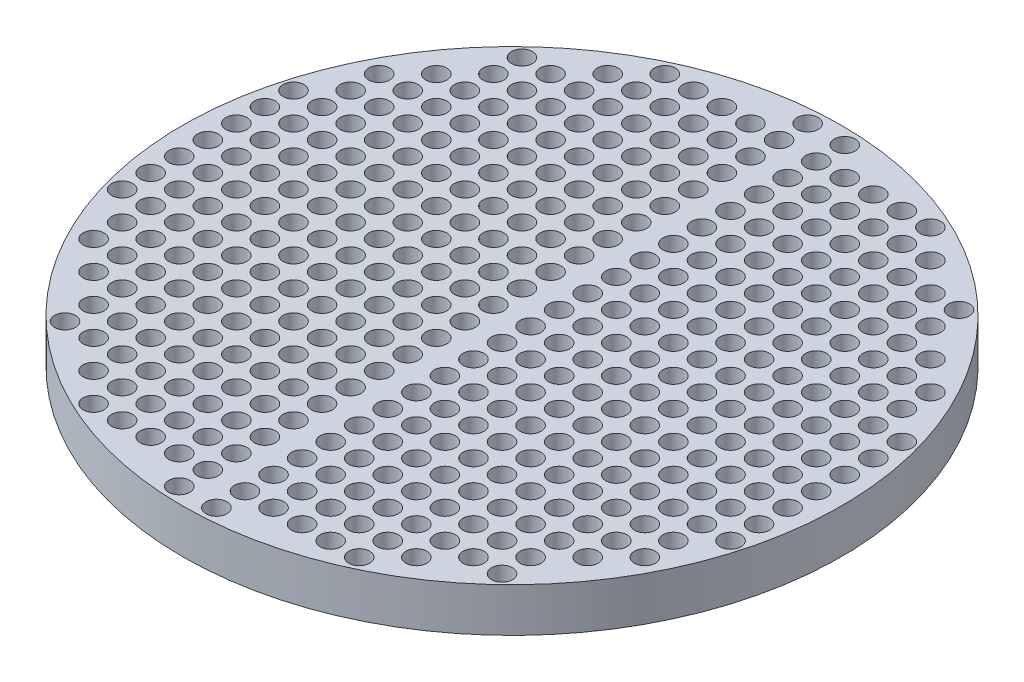
from build123d import *

# Parameters (mm, degrees)
SKETCH2_R          = 9.525
CUT_EXTRUDE1_DEPTH = 427.145515053


with BuildPart() as part:
    # Эскиз1 → Повернуть1 (revolve)
    with BuildSketch(Plane.XY):
        Polygon((-230, 35), (-259, 35), (-300, 35), (-300, 75), (0, 75), (0, 35), align=None)
    revolve(axis=Axis((0, 0, 0), (0, 1, 0)))

    # Sketch2 → Cut-Extrude1 (cut, through all)
    with BuildSketch(Plane(origin=(0, 75, 0), x_dir=(1, 0, 0), z_dir=(0, 1, 0))):
        with Locations((16.915767562, 0)):
            Circle(SKETCH2_R)
        with Locations((42.915767562, 0)):
            Circle(SKETCH2_R)
        with Locations((68.915767562, 0)):
            Circle(SKETCH2_R)
        with Locations((94.915767562, 0)):
            Circle(SKETCH2_R)
        with Locations((120.915767562, 0)):
            Circle(SKETCH2_R)
        with Locations((146.915767562, 0)):
            Circle(SKETCH2_R)
        with Locations((172.915767562, 0)):
            Circle(SKETCH2_R)
        with Locations((198.915767562, 0)):
            Circle(SKETCH2_R)
        with Locations((224.915767562, 0)):
            Circle(SKETCH2_R)
        with Locations((250.915767562, 0)):
            Circle(SKETCH2_R)
        with Locations((276.915767562, 0)):
            Circle(SKETCH2_R)
        with Locations((42.915767562, 26)):
            Circle(SKETCH2_R)
        with Locations((68.915767562, 26)):
            Circle(SKETCH2_R)
        with Locations((94.915767562, 26)):
            Circle(SKETCH2_R)
        with Locations((120.915767562, 26)):
            Circle(SKETCH2_R)
        with Locations((146.915767562, 26)):
            Circle(SKETCH2_R)
        with Locations((172.915767562, 26)):
            Circle(SKETCH2_R)
        with Locations((198.915767562, 26)):
            Circle(SKETCH2_R)
        with Locations((224.915767562, 26)):
            Circle(SKETCH2_R)
        with Locations((250.915767562, 26)):
            Circle(SKETCH2_R)
        with Locations((276.915767562, 26)):
            Circle(SKETCH2_R)
        with Locations((42.915767562, 52)):
            Circle(SKETCH2_R)
        with Locations((68.915767562, 52)):
            Circle(SKETCH2_R)
        with Locations((94.915767562, 52)):
            Circle(SKETCH2_R)
        with Locations((120.915767562, 52)):
            Circle(SKETCH2_R)
        with Locations((146.915767562, 52)):
            Circle(SKETCH2_R)
        with Locations((172.915767562, 52)):
            Circle(SKETCH2_R)
        with Locations((198.915767562, 52)):
            Circle(SKETCH2_R)
        with Locations((224.915767562, 52)):
            Circle(SKETCH2_R)
        with Locations((250.915767562, 52)):
            Circle(SKETCH2_R)
        with Locations((276.915767562, 52)):
            Circle(SKETCH2_R)
        with Locations((42.915767562, 78)):
            Circle(SKETCH2_R)
        with Locations((68.915767562, 78)):
            Circle(SKETCH2_R)
        with Locations((94.915767562, 78)):
            Circle(SKETCH2_R)
        with Locations((120.915767562, 78)):
            Circle(SKETCH2_R)
        with Locations((146.915767562, 78)):
            Circle(SKETCH2_R)
        with Locations((172.915767562, 78)):
            Circle(SKETCH2_R)
        with Locations((198.915767562, 78)):
            Circle(SKETCH2_R)
        with Locations((224.915767562, 78)):
            Circle(SKETCH2_R)
        with Locations((250.915767562, 78)):
            Circle(SKETCH2_R)
        with Locations((276.915767562, 78)):
            Circle(SKETCH2_R)
        with Locations((42.915767562, 104)):
            Circle(SKETCH2_R)
        with Locations((68.915767562, 104)):
            Circle(SKETCH2_R)
        with Locations((94.915767562, 104)):
            Circle(SKETCH2_R)
        with Locations((120.915767562, 104)):
            Circle(SKETCH2_R)
        with Locations((146.915767562, 104)):
            Circle(SKETCH2_R)
        with Locations((172.915767562, 104)):
            Circle(SKETCH2_R)
        with Locations((198.915767562, 104)):
            Circle(SKETCH2_R)
        with Locations((224.915767562, 104)):
            Circle(SKETCH2_R)
        with Locations((250.915767562, 104)):
            Circle(SKETCH2_R)
        with Locations((16.915767562, -286)):
            Circle(SKETCH2_R)
        with Locations((42.915767562, 130)):
            Circle(SKETCH2_R)
        with Locations((68.915767562, 130)):
            Circle(SKETCH2_R)
        with Locations((94.915767562, 130)):
            Circle(SKETCH2_R)
        with Locations((120.915767562, 130)):
            Circle(SKETCH2_R)
        with Locations((146.915767562, 130)):
            Circle(SKETCH2_R)
        with Locations((172.915767562, 130)):
            Circle(SKETCH2_R)
        with Locations((198.915767562, 130)):
            Circle(SKETCH2_R)
        with Locations((224.915767562, 130)):
            Circle(SKETCH2_R)
        with Locations((250.915767562, 130)):
            Circle(SKETCH2_R)
        with Locations((16.915767562, -260)):
            Circle(SKETCH2_R)
        with Locations((42.915767562, 156)):
            Circle(SKETCH2_R)
        with Locations((68.915767562, 156)):
            Circle(SKETCH2_R)
        with Locations((94.915767562, 156)):
            Circle(SKETCH2_R)
        with Locations((120.915767562, 156)):
            Circle(SKETCH2_R)
        with Locations((146.915767562, 156)):
            Circle(SKETCH2_R)
        with Locations((172.915767562, 156)):
            Circle(SKETCH2_R)
        with Locations((198.915767562, 156)):
            Circle(SKETCH2_R)
        with Locations((224.915767562, 156)):
            Circle(SKETCH2_R)
        with Locations((16.915767562, -234)):
            Circle(SKETCH2_R)
        with Locations((16.915767562, -208)):
            Circle(SKETCH2_R)
        with Locations((42.915767562, 182)):
            Circle(SKETCH2_R)
        with Locations((68.915767562, 182)):
            Circle(SKETCH2_R)
        with Locations((94.915767562, 182)):
            Circle(SKETCH2_R)
        with Locations((120.915767562, 182)):
            Circle(SKETCH2_R)
        with Locations((146.915767562, 182)):
            Circle(SKETCH2_R)
        with Locations((172.915767562, 182)):
            Circle(SKETCH2_R)
        with Locations((198.915767562, 182)):
            Circle(SKETCH2_R)
        with Locations((16.915767562, -182)):
            Circle(SKETCH2_R)
        with Locations((16.915767562, -156)):
            Circle(SKETCH2_R)
        with Locations((16.915767562, -130)):
            Circle(SKETCH2_R)
        with Locations((42.915767562, 208)):
            Circle(SKETCH2_R)
        with Locations((68.915767562, 208)):
            Circle(SKETCH2_R)
        with Locations((94.915767562, 208)):
            Circle(SKETCH2_R)
        with Locations((120.915767562, 208)):
            Circle(SKETCH2_R)
        with Locations((146.915767562, 208)):
            Circle(SKETCH2_R)
        with Locations((172.915767562, 208)):
            Circle(SKETCH2_R)
        with Locations((198.915767562, 208)):
            Circle(SKETCH2_R)
        with Locations((16.915767562, -104)):
            Circle(SKETCH2_R)
        with Locations((16.915767562, -78)):
            Circle(SKETCH2_R)
        with Locations((16.915767562, -52)):
            Circle(SKETCH2_R)
        with Locations((42.915767562, 234)):
            Circle(SKETCH2_R)
        with Locations((68.915767562, 234)):
            Circle(SKETCH2_R)
        with Locations((94.915767562, 234)):
            Circle(SKETCH2_R)
        with Locations((120.915767562, 234)):
            Circle(SKETCH2_R)
        with Locations((146.915767562, 234)):
            Circle(SKETCH2_R)
        with Locations((16.915767562, -26)):
            Circle(SKETCH2_R)
        with Locations((120.915767562, -260)):
            Circle(SKETCH2_R)
        with Locations((94.915767562, -260)):
            Circle(SKETCH2_R)
        with Locations((68.915767562, -260)):
            Circle(SKETCH2_R)
        with Locations((42.915767562, -260)):
            Circle(SKETCH2_R)
        with Locations((42.915767562, 260)):
            Circle(SKETCH2_R)
        with Locations((68.915767562, 260)):
            Circle(SKETCH2_R)
        with Locations((94.915767562, 260)):
            Circle(SKETCH2_R)
        with Locations((120.915767562, 260)):
            Circle(SKETCH2_R)
        with Locations((146.915767562, -234)):
            Circle(SKETCH2_R)
        with Locations((120.915767562, -234)):
            Circle(SKETCH2_R)
        with Locations((94.915767562, -234)):
            Circle(SKETCH2_R)
        with Locations((68.915767562, -234)):
            Circle(SKETCH2_R)
        with Locations((42.915767562, -234)):
            Circle(SKETCH2_R)
        with Locations((198.915767562, -208)):
            Circle(SKETCH2_R)
        with Locations((172.915767562, -208)):
            Circle(SKETCH2_R)
        with Locations((146.915767562, -208)):
            Circle(SKETCH2_R)
        with Locations((120.915767562, -208)):
            Circle(SKETCH2_R)
        with Locations((94.915767562, -208)):
            Circle(SKETCH2_R)
        with Locations((68.915767562, -208)):
            Circle(SKETCH2_R)
        with Locations((42.915767562, -208)):
            Circle(SKETCH2_R)
        with Locations((198.915767562, -182)):
            Circle(SKETCH2_R)
        with Locations((172.915767562, -182)):
            Circle(SKETCH2_R)
        with Locations((146.915767562, -182)):
            Circle(SKETCH2_R)
        with Locations((120.915767562, -182)):
            Circle(SKETCH2_R)
        with Locations((16.915767562, 26)):
            Circle(SKETCH2_R)
        with Locations((16.915767562, 52)):
            Circle(SKETCH2_R)
        with Locations((16.915767562, 78)):
            Circle(SKETCH2_R)
        with Locations((16.915767562, 104)):
            Circle(SKETCH2_R)
        with Locations((16.915767562, 130)):
            Circle(SKETCH2_R)
        with Locations((16.915767562, 156)):
            Circle(SKETCH2_R)
        with Locations((16.915767562, 182)):
            Circle(SKETCH2_R)
        with Locations((16.915767562, 208)):
            Circle(SKETCH2_R)
        with Locations((16.915767562, 234)):
            Circle(SKETCH2_R)
        with Locations((16.915767562, 260)):
            Circle(SKETCH2_R)
        with Locations((16.915767562, 286)):
            Circle(SKETCH2_R)
        with Locations((94.915767562, -182)):
            Circle(SKETCH2_R)
        with Locations((68.915767562, -182)):
            Circle(SKETCH2_R)
        with Locations((42.915767562, -182)):
            Circle(SKETCH2_R)
        with Locations((224.915767562, -156)):
            Circle(SKETCH2_R)
        with Locations((198.915767562, -156)):
            Circle(SKETCH2_R)
        with Locations((172.915767562, -156)):
            Circle(SKETCH2_R)
        with Locations((146.915767562, -156)):
            Circle(SKETCH2_R)
        with Locations((120.915767562, -156)):
            Circle(SKETCH2_R)
        with Locations((94.915767562, -156)):
            Circle(SKETCH2_R)
        with Locations((68.915767562, -156)):
            Circle(SKETCH2_R)
        with Locations((42.915767562, -156)):
            Circle(SKETCH2_R)
        with Locations((250.915767562, -130)):
            Circle(SKETCH2_R)
        with Locations((224.915767562, -130)):
            Circle(SKETCH2_R)
        with Locations((198.915767562, -130)):
            Circle(SKETCH2_R)
        with Locations((172.915767562, -130)):
            Circle(SKETCH2_R)
        with Locations((146.915767562, -130)):
            Circle(SKETCH2_R)
        with Locations((120.915767562, -130)):
            Circle(SKETCH2_R)
        with Locations((94.915767562, -130)):
            Circle(SKETCH2_R)
        with Locations((68.915767562, -130)):
            Circle(SKETCH2_R)
        with Locations((42.915767562, -130)):
            Circle(SKETCH2_R)
        with Locations((250.915767562, -104)):
            Circle(SKETCH2_R)
        with Locations((224.915767562, -104)):
            Circle(SKETCH2_R)
        with Locations((198.915767562, -104)):
            Circle(SKETCH2_R)
        with Locations((172.915767562, -104)):
            Circle(SKETCH2_R)
        with Locations((146.915767562, -104)):
            Circle(SKETCH2_R)
        with Locations((120.915767562, -104)):
            Circle(SKETCH2_R)
        with Locations((94.915767562, -104)):
            Circle(SKETCH2_R)
        with Locations((68.915767562, -104)):
            Circle(SKETCH2_R)
        with Locations((42.915767562, -104)):
            Circle(SKETCH2_R)
        with Locations((276.915767562, -78)):
            Circle(SKETCH2_R)
        with Locations((250.915767562, -78)):
            Circle(SKETCH2_R)
        with Locations((224.915767562, -78)):
            Circle(SKETCH2_R)
        with Locations((198.915767562, -78)):
            Circle(SKETCH2_R)
        with Locations((172.915767562, -78)):
            Circle(SKETCH2_R)
        with Locations((146.915767562, -78)):
            Circle(SKETCH2_R)
        with Locations((120.915767562, -78)):
            Circle(SKETCH2_R)
        with Locations((94.915767562, -78)):
            Circle(SKETCH2_R)
        with Locations((68.915767562, -78)):
            Circle(SKETCH2_R)
        with Locations((42.915767562, -78)):
            Circle(SKETCH2_R)
        with Locations((276.915767562, -52)):
            Circle(SKETCH2_R)
        with Locations((250.915767562, -52)):
            Circle(SKETCH2_R)
        with Locations((224.915767562, -52)):
            Circle(SKETCH2_R)
        with Locations((198.915767562, -52)):
            Circle(SKETCH2_R)
        with Locations((172.915767562, -52)):
            Circle(SKETCH2_R)
        with Locations((146.915767562, -52)):
            Circle(SKETCH2_R)
        with Locations((120.915767562, -52)):
            Circle(SKETCH2_R)
        with Locations((94.915767562, -52)):
            Circle(SKETCH2_R)
        with Locations((68.915767562, -52)):
            Circle(SKETCH2_R)
        with Locations((42.915767562, -52)):
            Circle(SKETCH2_R)
        with Locations((276.915767562, -26)):
            Circle(SKETCH2_R)
        with Locations((250.915767562, -26)):
            Circle(SKETCH2_R)
        with Locations((224.915767562, -26)):
            Circle(SKETCH2_R)
        with Locations((198.915767562, -26)):
            Circle(SKETCH2_R)
        with Locations((172.915767562, -26)):
            Circle(SKETCH2_R)
        with Locations((146.915767562, -26)):
            Circle(SKETCH2_R)
        with Locations((120.915767562, -26)):
            Circle(SKETCH2_R)
        with Locations((94.915767562, -26)):
            Circle(SKETCH2_R)
        with Locations((68.915767562, -26)):
            Circle(SKETCH2_R)
        with Locations((42.915767562, -26)):
            Circle(SKETCH2_R)
        with Locations((-42.915767562, -26)):
            Circle(SKETCH2_R)
        with Locations((-68.915767562, -26)):
            Circle(SKETCH2_R)
        with Locations((-94.915767562, -26)):
            Circle(SKETCH2_R)
        with Locations((-120.915767562, -26)):
            Circle(SKETCH2_R)
        with Locations((-146.915767562, -26)):
            Circle(SKETCH2_R)
        with Locations((-172.915767562, -26)):
            Circle(SKETCH2_R)
        with Locations((-198.915767562, -26)):
            Circle(SKETCH2_R)
        with Locations((-224.915767562, -26)):
            Circle(SKETCH2_R)
        with Locations((-250.915767562, -26)):
            Circle(SKETCH2_R)
        with Locations((-276.915767562, -26)):
            Circle(SKETCH2_R)
        with Locations((-42.915767562, -52)):
            Circle(SKETCH2_R)
        with Locations((-68.915767562, -52)):
            Circle(SKETCH2_R)
        with Locations((-94.915767562, -52)):
            Circle(SKETCH2_R)
        with Locations((-120.915767562, -52)):
            Circle(SKETCH2_R)
        with Locations((-146.915767562, -52)):
            Circle(SKETCH2_R)
        with Locations((-172.915767562, -52)):
            Circle(SKETCH2_R)
        with Locations((-198.915767562, -52)):
            Circle(SKETCH2_R)
        with Locations((-224.915767562, -52)):
            Circle(SKETCH2_R)
        with Locations((-250.915767562, -52)):
            Circle(SKETCH2_R)
        with Locations((-276.915767562, -52)):
            Circle(SKETCH2_R)
        with Locations((-42.915767562, -78)):
            Circle(SKETCH2_R)
        with Locations((-68.915767562, -78)):
            Circle(SKETCH2_R)
        with Locations((-94.915767562, -78)):
            Circle(SKETCH2_R)
        with Locations((-120.915767562, -78)):
            Circle(SKETCH2_R)
        with Locations((-146.915767562, -78)):
            Circle(SKETCH2_R)
        with Locations((-172.915767562, -78)):
            Circle(SKETCH2_R)
        with Locations((-198.915767562, -78)):
            Circle(SKETCH2_R)
        with Locations((-224.915767562, -78)):
            Circle(SKETCH2_R)
        with Locations((-250.915767562, -78)):
            Circle(SKETCH2_R)
        with Locations((-276.915767562, -78)):
            Circle(SKETCH2_R)
        with Locations((-42.915767562, -104)):
            Circle(SKETCH2_R)
        with Locations((-68.915767562, -104)):
            Circle(SKETCH2_R)
        with Locations((-94.915767562, -104)):
            Circle(SKETCH2_R)
        with Locations((-120.915767562, -104)):
            Circle(SKETCH2_R)
        with Locations((-146.915767562, -104)):
            Circle(SKETCH2_R)
        with Locations((-172.915767562, -104)):
            Circle(SKETCH2_R)
        with Locations((-198.915767562, -104)):
            Circle(SKETCH2_R)
        with Locations((-224.915767562, -104)):
            Circle(SKETCH2_R)
        with Locations((-250.915767562, -104)):
            Circle(SKETCH2_R)
        with Locations((-42.915767562, -130)):
            Circle(SKETCH2_R)
        with Locations((-68.915767562, -130)):
            Circle(SKETCH2_R)
        with Locations((-94.915767562, -130)):
            Circle(SKETCH2_R)
        with Locations((-120.915767562, -130)):
            Circle(SKETCH2_R)
        with Locations((-146.915767562, -130)):
            Circle(SKETCH2_R)
        with Locations((-172.915767562, -130)):
            Circle(SKETCH2_R)
        with Locations((-198.915767562, -130)):
            Circle(SKETCH2_R)
        with Locations((-224.915767562, -130)):
            Circle(SKETCH2_R)
        with Locations((-250.915767562, -130)):
            Circle(SKETCH2_R)
        with Locations((-42.915767562, -156)):
            Circle(SKETCH2_R)
        with Locations((-68.915767562, -156)):
            Circle(SKETCH2_R)
        with Locations((-94.915767562, -156)):
            Circle(SKETCH2_R)
        with Locations((-120.915767562, -156)):
            Circle(SKETCH2_R)
        with Locations((-146.915767562, -156)):
            Circle(SKETCH2_R)
        with Locations((-172.915767562, -156)):
            Circle(SKETCH2_R)
        with Locations((-198.915767562, -156)):
            Circle(SKETCH2_R)
        with Locations((-224.915767562, -156)):
            Circle(SKETCH2_R)
        with Locations((-42.915767562, -182)):
            Circle(SKETCH2_R)
        with Locations((-68.915767562, -182)):
            Circle(SKETCH2_R)
        with Locations((-94.915767562, -182)):
            Circle(SKETCH2_R)
        with Locations((-16.915767562, 286)):
            Circle(SKETCH2_R)
        with Locations((-16.915767562, 260)):
            Circle(SKETCH2_R)
        with Locations((-16.915767562, 234)):
            Circle(SKETCH2_R)
        with Locations((-16.915767562, 208)):
            Circle(SKETCH2_R)
        with Locations((-16.915767562, 182)):
            Circle(SKETCH2_R)
        with Locations((-16.915767562, 156)):
            Circle(SKETCH2_R)
        with Locations((-16.915767562, 130)):
            Circle(SKETCH2_R)
        with Locations((-16.915767562, 104)):
            Circle(SKETCH2_R)
        with Locations((-16.915767562, 78)):
            Circle(SKETCH2_R)
        with Locations((-16.915767562, 52)):
            Circle(SKETCH2_R)
        with Locations((-16.915767562, 26)):
            Circle(SKETCH2_R)
        with Locations((-120.915767562, -182)):
            Circle(SKETCH2_R)
        with Locations((-146.915767562, -182)):
            Circle(SKETCH2_R)
        with Locations((-172.915767562, -182)):
            Circle(SKETCH2_R)
        with Locations((-198.915767562, -182)):
            Circle(SKETCH2_R)
        with Locations((-42.915767562, -208)):
            Circle(SKETCH2_R)
        with Locations((-68.915767562, -208)):
            Circle(SKETCH2_R)
        with Locations((-94.915767562, -208)):
            Circle(SKETCH2_R)
        with Locations((-120.915767562, -208)):
            Circle(SKETCH2_R)
        with Locations((-146.915767562, -208)):
            Circle(SKETCH2_R)
        with Locations((-172.915767562, -208)):
            Circle(SKETCH2_R)
        with Locations((-198.915767562, -208)):
            Circle(SKETCH2_R)
        with Locations((-42.915767562, -234)):
            Circle(SKETCH2_R)
        with Locations((-68.915767562, -234)):
            Circle(SKETCH2_R)
        with Locations((-94.915767562, -234)):
            Circle(SKETCH2_R)
        with Locations((-120.915767562, -234)):
            Circle(SKETCH2_R)
        with Locations((-146.915767562, -234)):
            Circle(SKETCH2_R)
        with Locations((-120.915767562, 260)):
            Circle(SKETCH2_R)
        with Locations((-94.915767562, 260)):
            Circle(SKETCH2_R)
        with Locations((-68.915767562, 260)):
            Circle(SKETCH2_R)
        with Locations((-42.915767562, 260)):
            Circle(SKETCH2_R)
        with Locations((-42.915767562, -260)):
            Circle(SKETCH2_R)
        with Locations((-68.915767562, -260)):
            Circle(SKETCH2_R)
        with Locations((-94.915767562, -260)):
            Circle(SKETCH2_R)
        with Locations((-120.915767562, -260)):
            Circle(SKETCH2_R)
        with Locations((-16.915767562, -26)):
            Circle(SKETCH2_R)
        with Locations((-146.915767562, 234)):
            Circle(SKETCH2_R)
        with Locations((-120.915767562, 234)):
            Circle(SKETCH2_R)
        with Locations((-94.915767562, 234)):
            Circle(SKETCH2_R)
        with Locations((-68.915767562, 234)):
            Circle(SKETCH2_R)
        with Locations((-42.915767562, 234)):
            Circle(SKETCH2_R)
        with Locations((-16.915767562, -52)):
            Circle(SKETCH2_R)
        with Locations((-16.915767562, -78)):
            Circle(SKETCH2_R)
        with Locations((-16.915767562, -104)):
            Circle(SKETCH2_R)
        with Locations((-198.915767562, 208)):
            Circle(SKETCH2_R)
        with Locations((-172.915767562, 208)):
            Circle(SKETCH2_R)
        with Locations((-146.915767562, 208)):
            Circle(SKETCH2_R)
        with Locations((-120.915767562, 208)):
            Circle(SKETCH2_R)
        with Locations((-94.915767562, 208)):
            Circle(SKETCH2_R)
        with Locations((-68.915767562, 208)):
            Circle(SKETCH2_R)
        with Locations((-42.915767562, 208)):
            Circle(SKETCH2_R)
        with Locations((-16.915767562, -130)):
            Circle(SKETCH2_R)
        with Locations((-16.915767562, -156)):
            Circle(SKETCH2_R)
        with Locations((-16.915767562, -182)):
            Circle(SKETCH2_R)
        with Locations((-198.915767562, 182)):
            Circle(SKETCH2_R)
        with Locations((-172.915767562, 182)):
            Circle(SKETCH2_R)
        with Locations((-146.915767562, 182)):
            Circle(SKETCH2_R)
        with Locations((-120.915767562, 182)):
            Circle(SKETCH2_R)
        with Locations((-94.915767562, 182)):
            Circle(SKETCH2_R)
        with Locations((-68.915767562, 182)):
            Circle(SKETCH2_R)
        with Locations((-42.915767562, 182)):
            Circle(SKETCH2_R)
        with Locations((-16.915767562, -208)):
            Circle(SKETCH2_R)
        with Locations((-16.915767562, -234)):
            Circle(SKETCH2_R)
        with Locations((-224.915767562, 156)):
            Circle(SKETCH2_R)
        with Locations((-198.915767562, 156)):
            Circle(SKETCH2_R)
        with Locations((-172.915767562, 156)):
            Circle(SKETCH2_R)
        with Locations((-146.915767562, 156)):
            Circle(SKETCH2_R)
        with Locations((-120.915767562, 156)):
            Circle(SKETCH2_R)
        with Locations((-94.915767562, 156)):
            Circle(SKETCH2_R)
        with Locations((-68.915767562, 156)):
            Circle(SKETCH2_R)
        with Locations((-42.915767562, 156)):
            Circle(SKETCH2_R)
        with Locations((-16.915767562, -260)):
            Circle(SKETCH2_R)
        with Locations((-250.915767562, 130)):
            Circle(SKETCH2_R)
        with Locations((-224.915767562, 130)):
            Circle(SKETCH2_R)
        with Locations((-198.915767562, 130)):
            Circle(SKETCH2_R)
        with Locations((-172.915767562, 130)):
            Circle(SKETCH2_R)
        with Locations((-146.915767562, 130)):
            Circle(SKETCH2_R)
        with Locations((-120.915767562, 130)):
            Circle(SKETCH2_R)
        with Locations((-94.915767562, 130)):
            Circle(SKETCH2_R)
        with Locations((-68.915767562, 130)):
            Circle(SKETCH2_R)
        with Locations((-42.915767562, 130)):
            Circle(SKETCH2_R)
        with Locations((-16.915767562, -286)):
            Circle(SKETCH2_R)
        with Locations((-250.915767562, 104)):
            Circle(SKETCH2_R)
        with Locations((-224.915767562, 104)):
            Circle(SKETCH2_R)
        with Locations((-198.915767562, 104)):
            Circle(SKETCH2_R)
        with Locations((-172.915767562, 104)):
            Circle(SKETCH2_R)
        with Locations((-146.915767562, 104)):
            Circle(SKETCH2_R)
        with Locations((-120.915767562, 104)):
            Circle(SKETCH2_R)
        with Locations((-94.915767562, 104)):
            Circle(SKETCH2_R)
        with Locations((-68.915767562, 104)):
            Circle(SKETCH2_R)
        with Locations((-42.915767562, 104)):
            Circle(SKETCH2_R)
        with Locations((-276.915767562, 78)):
            Circle(SKETCH2_R)
        with Locations((-250.915767562, 78)):
            Circle(SKETCH2_R)
        with Locations((-224.915767562, 78)):
            Circle(SKETCH2_R)
        with Locations((-198.915767562, 78)):
            Circle(SKETCH2_R)
        with Locations((-172.915767562, 78)):
            Circle(SKETCH2_R)
        with Locations((-146.915767562, 78)):
            Circle(SKETCH2_R)
        with Locations((-120.915767562, 78)):
            Circle(SKETCH2_R)
        with Locations((-94.915767562, 78)):
            Circle(SKETCH2_R)
        with Locations((-68.915767562, 78)):
            Circle(SKETCH2_R)
        with Locations((-42.915767562, 78)):
            Circle(SKETCH2_R)
        with Locations((-276.915767562, 52)):
            Circle(SKETCH2_R)
        with Locations((-250.915767562, 52)):
            Circle(SKETCH2_R)
        with Locations((-224.915767562, 52)):
            Circle(SKETCH2_R)
        with Locations((-198.915767562, 52)):
            Circle(SKETCH2_R)
        with Locations((-172.915767562, 52)):
            Circle(SKETCH2_R)
        with Locations((-146.915767562, 52)):
            Circle(SKETCH2_R)
        with Locations((-120.915767562, 52)):
            Circle(SKETCH2_R)
        with Locations((-94.915767562, 52)):
            Circle(SKETCH2_R)
        with Locations((-68.915767562, 52)):
            Circle(SKETCH2_R)
        with Locations((-42.915767562, 52)):
            Circle(SKETCH2_R)
        with Locations((-276.915767562, 26)):
            Circle(SKETCH2_R)
        with Locations((-250.915767562, 26)):
            Circle(SKETCH2_R)
        with Locations((-224.915767562, 26)):
            Circle(SKETCH2_R)
        with Locations((-198.915767562, 26)):
            Circle(SKETCH2_R)
        with Locations((-172.915767562, 26)):
            Circle(SKETCH2_R)
        with Locations((-146.915767562, 26)):
            Circle(SKETCH2_R)
        with Locations((-120.915767562, 26)):
            Circle(SKETCH2_R)
        with Locations((-94.915767562, 26)):
            Circle(SKETCH2_R)
        with Locations((-68.915767562, 26)):
            Circle(SKETCH2_R)
        with Locations((-42.915767562, 26)):
            Circle(SKETCH2_R)
        with Locations((-276.915767562, 0)):
            Circle(SKETCH2_R)
        with Locations((-250.915767562, 0)):
            Circle(SKETCH2_R)
        with Locations((-224.915767562, 0)):
            Circle(SKETCH2_R)
        with Locations((-198.915767562, 0)):
            Circle(SKETCH2_R)
        with Locations((-172.915767562, 0)):
            Circle(SKETCH2_R)
        with Locations((-146.915767562, 0)):
            Circle(SKETCH2_R)
        with Locations((-120.915767562, 0)):
            Circle(SKETCH2_R)
        with Locations((-94.915767562, 0)):
            Circle(SKETCH2_R)
        with Locations((-68.915767562, 0)):
            Circle(SKETCH2_R)
        with Locations((-42.915767562, 0)):
            Circle(SKETCH2_R)
        with Locations((-16.915767562, 0)):
            Circle(SKETCH2_R)
    extrude(amount=-CUT_EXTRUDE1_DEPTH, mode=Mode.SUBTRACT)


solid = part.part
